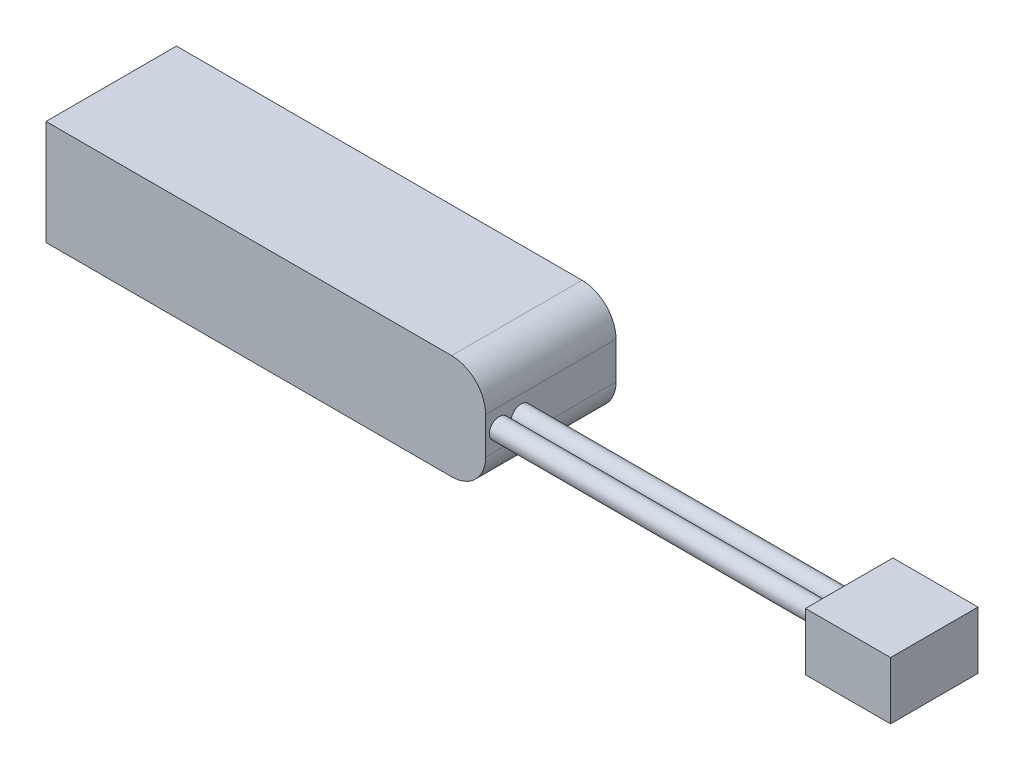
from build123d import *

# Parameters (mm, degrees)
CROQUIS4_W              = 155
CROQUIS4_H              = 37
SALIENTE_EXTRUIR3_DEPTH = 23
REDONDEO1_R             = 12
CROQUIS6_R              = 3.484672525
SALIENTE_EXTRUIR4_DEPTH = 120
CROQUIS11_W             = 30.831306564
CROQUIS11_H             = 20.264796923
SALIENTE_EXTRUIR8_DEPTH = 30
CROQUIS12_R             = 3.474840626
SALIENTE_EXTRUIR9_DEPTH = 123


with BuildPart() as part:
    # Croquis4 → Saliente-Extruir3 (new, symmetric)
    with BuildSketch(Plane.XY):
        Rectangle(CROQUIS4_W, CROQUIS4_H)
    extrude(amount=SALIENTE_EXTRUIR3_DEPTH, both=True)

    # Redondeo1
    redondeo1_edges = [part.edges().sort_by_distance(p)[0] for p in [
        (77.5, -18.5, 0),
        (77.5, 18.5, 0),
    ]]
    fillet(redondeo1_edges, radius=REDONDEO1_R)

    # Croquis6 → Saliente-Extruir4 (add)
    with BuildSketch(Plane(origin=(77.5, 0, 0), x_dir=(0, 0, -1), z_dir=(1, 0, 0))):
        with Locations((-18.206269691, 0)):
            Circle(CROQUIS6_R)
    extrude(amount=SALIENTE_EXTRUIR4_DEPTH)

    # Croquis11 → Saliente-Extruir8 (add)
    with BuildSketch(Plane(origin=(197.5, 0, 0), x_dir=(0, 0, -1), z_dir=(1, 0, 0))):
        with Locations((-14.807454784, 0.768765135)):
            Rectangle(CROQUIS11_W, CROQUIS11_H)
    extrude(amount=SALIENTE_EXTRUIR8_DEPTH)

    # Croquis12 → Saliente-Extruir9 (add)
    with BuildSketch(Plane(origin=(77.5, 0, 0), x_dir=(0, 0, -1), z_dir=(1, 0, 0))):
        with Locations((-10.529855547, 0)):
            Circle(CROQUIS12_R)
    extrude(amount=SALIENTE_EXTRUIR9_DEPTH)


solid = part.part
